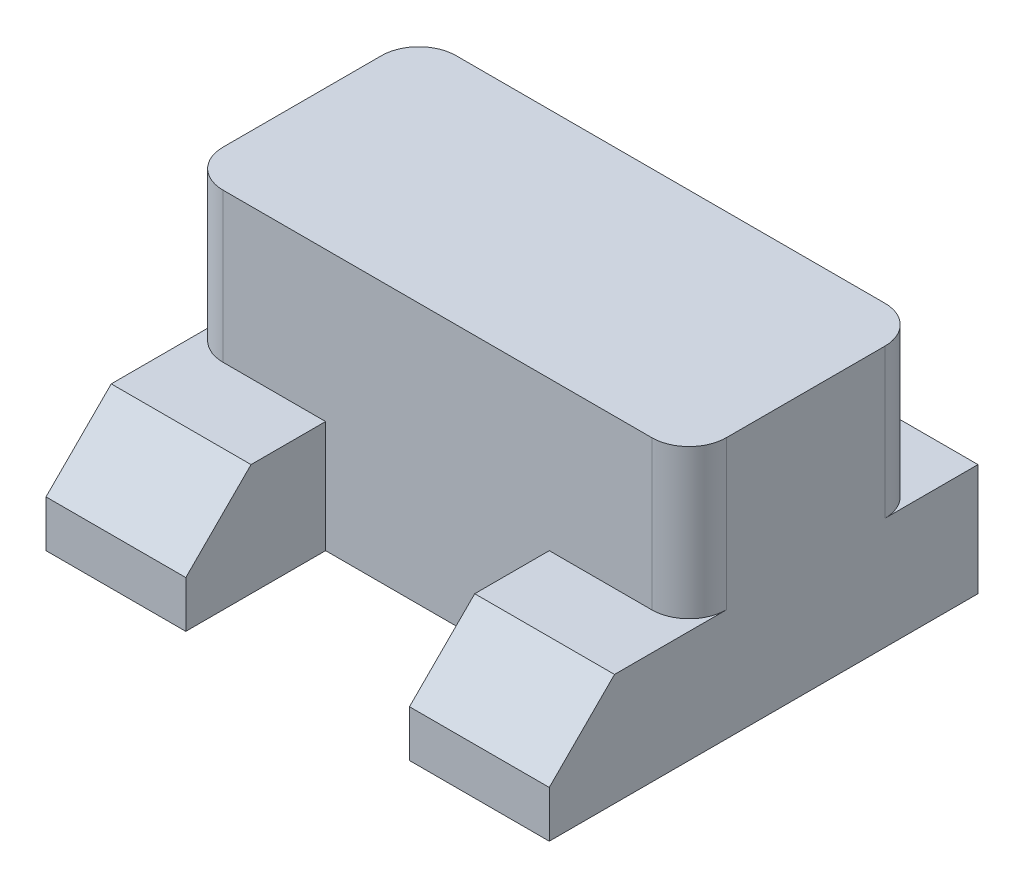
from build123d import *

# Parameters (mm, degrees)
EXTRUDE_3_DEPTH      = 1.6
EXTRUDE_3_DEPTH_BACK = 1.2
SKETCH_2_W           = 5.4
SKETCH_2_H           = 2.5
EXTRUDE_4_DEPTH      = 1.2
SKETCH_5_W           = 4
SKETCH_5_H           = 1.5
EXTRUDE_7_DEPTH      = 0.5
SKETCH_6_W           = 1.5
SKETCH_6_H           = 1.2
EXTRUDE_8_DEPTH      = 0.6
SKETCH_7_W           = 1.5
SKETCH_7_H           = 1.2
EXTRUDE_9_DEPTH      = 1.5
CHAMFER_2_SIZE       = 0.7


with BuildPart() as part:
    # 草图1 → 凸台-拉伸3 (new, two sides: drawn at the far end of the back side and taken through both)
    with BuildSketch(Plane(origin=(0, 0, 0), x_dir=(1, 0, 0), z_dir=(0, 1, 0)).offset(-EXTRUDE_3_DEPTH_BACK)):
        with BuildLine():
            Line((-2.7, 0.85), (-2.7, -0.85))
            ThreePointArc((-2.7, -0.85), (-2.582842712, -1.132842712), (-2.3, -1.25))
            Line((-2.3, -1.25), (2.3, -1.25))
            ThreePointArc((2.3, -1.25), (2.582842712, -1.132842712), (2.7, -0.85))
            Line((2.7, -0.85), (2.7, 0.85))
            ThreePointArc((2.7, 0.85), (2.582842712, 1.132842712), (2.3, 1.25))
            Line((2.3, 1.25), (-2.3, 1.25))
            ThreePointArc((-2.3, 1.25), (-2.582842712, 1.132842712), (-2.7, 0.85))
        make_face()
    extrude(amount=EXTRUDE_3_DEPTH + EXTRUDE_3_DEPTH_BACK)

    # 草图2 → 凸台-拉伸4 (add)
    with BuildSketch(Plane(origin=(0, 0, 0), x_dir=(1, 0, 0), z_dir=(0, 1, 0))):
        Rectangle(SKETCH_2_W, SKETCH_2_H)
    extrude(amount=-EXTRUDE_4_DEPTH)

    # 草图5 → 凸台-拉伸7 (add)
    with BuildSketch(Plane(origin=(0, -1.2, 0), x_dir=(-1, 0, 0), z_dir=(0, -1, 0))):
        with Locations((0, 0.15)):
            Rectangle(SKETCH_5_W, SKETCH_5_H)
    extrude(amount=EXTRUDE_7_DEPTH)

    # 草图6 → 凸台-拉伸8 (add)
    with BuildSketch(Plane(origin=(0, 0, -1.25), x_dir=(-1, 0, 0), z_dir=(0, 0, -1))):
        with Locations((1.95, -0.6)):
            Rectangle(SKETCH_6_W, SKETCH_6_H)
        with Locations((-1.95, -0.6)):
            Rectangle(SKETCH_6_W, SKETCH_6_H)
    extrude(amount=EXTRUDE_8_DEPTH)

    # 草图7 → 凸台-拉伸9 (add)
    with BuildSketch(Plane.XY.offset(1.25)):
        with Locations((1.95, -0.6)):
            Rectangle(SKETCH_7_W, SKETCH_7_H)
        with Locations((-1.95, -0.6)):
            Rectangle(SKETCH_7_W, SKETCH_7_H)
    extrude(amount=EXTRUDE_9_DEPTH)

    # 倒角2
    chamfer_2_edges = [part.edges().sort_by_distance(p)[0] for p in [
        (-1.95, 0, 2.75),
        (1.95, 0, 2.75),
    ]]
    chamfer(chamfer_2_edges, length=CHAMFER_2_SIZE)


solid = part.part
